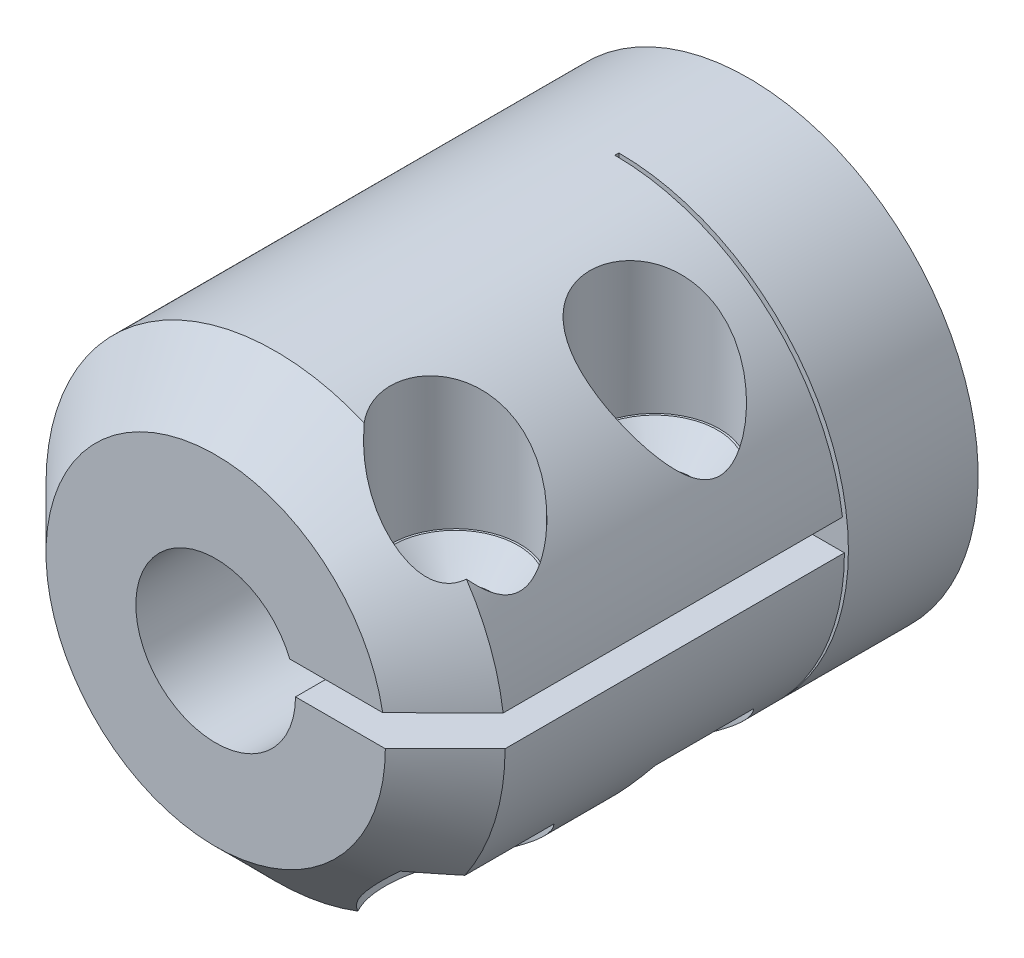
from build123d import *
from build123d.topology import SkipClean

# Parameters (mm, degrees)
SZKIC1_R                                           = 11.5
SZKIC1_R_2                                         = 4
DODANIE_WYCI_GNI_CIE1_DEPTH                        = 20
SZKIC3_W                                           = 11.5
SZKIC3_H                                           = 20
WYTNIJ_WYCI_GNI_CIE1_DEPTH                         = 1.5
WYTNIJ_WYCI_GNI_CIE2_DEPTH                         = 32
POG_BIENIE_STO_KOWE_POD_M3_WKR_T_Z_BEM_D           = 3.6
POG_BIENIE_STO_KOWE_POD_M3_WKR_T_Z_BEM_CSINK_D     = 6.3
POG_BIENIE_STO_KOWE_POD_M3_WKR_T_Z_BEM_CSINK_ANGLE = 90
SZKIC7_R                                           = 3.5
WYTNIJ_WYCI_GNI_CIE3_DEPTH                         = 32
SZKIC8_R                                           = 2
WYTNIJ_WYCI_GNI_CIE4_DEPTH                         = 7
DODANIE_WYCI_GNI_CIE2_START                        = 0.2
DODANIE_WYCI_GNI_CIE2_DEPTH                        = 0.2
DODANIE_WYCI_GNI_CIE3_START                        = 1.5
SZKIC10_R                                          = 11.5
DODANIE_WYCI_GNI_CIE3_DEPTH                        = 1.5
DODANIE_WYCI_GNI_CIE4_START                        = 5
SZKIC11_R                                          = 11.5
SZKIC11_W                                          = 10
SZKIC11_H                                          = 10
DODANIE_WYCI_GNI_CIE4_DEPTH                        = 5
SFAZOWANIE1_SIZE                                   = 3


with BuildPart() as part:
    # Szkic1 → Dodanie-wyciągnięcie1 (new body)
    with BuildSketch(Plane.XY):
        with Locations(Location((0, 0, 0), (0, 0, 180))):
            Circle(SZKIC1_R)
        with Locations(Location((0, 0, 0), (0, 0, 180))):
            Circle(SZKIC1_R_2, mode=Mode.SUBTRACT)
    extrude(amount=DODANIE_WYCI_GNI_CIE1_DEPTH)

    # Szkic3 → Wytnij-wyciągnięcie1 (cut)
    with BuildSketch(Plane(origin=(0, 0, 0), x_dir=(1, 0, 0), z_dir=(0, 1, 0))):
        with Locations((5.75, -10)):
            Rectangle(SZKIC3_W, SZKIC3_H)
    extrude(amount=WYTNIJ_WYCI_GNI_CIE1_DEPTH, mode=Mode.SUBTRACT)

    # Szkic4 → Wytnij-wyciągnięcie2 (cut)
    with BuildSketch(Plane(origin=(0, 4, 0), x_dir=(1, 0, 0), z_dir=(0, 1, 0))):
        with BuildLine():
            ThreePointArc((7, -11.75), (3.75, -15), (7, -18.25))
            Line((7, -18.25), (7, -11.75))
        make_face()
        with BuildLine():
            Line((7, -11.75), (7, -18.25))
            ThreePointArc((7, -18.25), (9.298097039, -17.298097039), (10.25, -15))
            ThreePointArc((10.25, -15), (9.298097039, -12.701902961), (7, -11.75))
        make_face()
        with BuildLine():
            ThreePointArc((7, -1.75), (3.75, -5), (7, -8.25))
            Line((7, -8.25), (7, -1.75))
        make_face()
        with BuildLine():
            Line((7, -1.75), (7, -8.25))
            ThreePointArc((7, -8.25), (9.298097039, -7.298097039), (10.25, -5))
            ThreePointArc((10.25, -5), (9.298097039, -2.701902961), (7, -1.75))
        make_face()
    extrude(amount=WYTNIJ_WYCI_GNI_CIE2_DEPTH, mode=Mode.SUBTRACT)

    # Pogłębienie stożkowe pod M3 Wkręt z łbem płaskim1 (through all)
    with Locations(Plane(origin=(7, 4, 15), x_dir=(0, 0, 1), z_dir=(0, 1, 0))):
        with Locations((0, 0), (-10, 0)):
            CounterSinkHole(POG_BIENIE_STO_KOWE_POD_M3_WKR_T_Z_BEM_D / 2, POG_BIENIE_STO_KOWE_POD_M3_WKR_T_Z_BEM_CSINK_D / 2, counter_sink_angle=POG_BIENIE_STO_KOWE_POD_M3_WKR_T_Z_BEM_CSINK_ANGLE)

    # Szkic7 → Wytnij-wyciągnięcie3 (cut)
    with BuildSketch(Plane(origin=(0, -6.5, 0), x_dir=(-1, 0, 0), z_dir=(0, -1, 0))):
        with Locations((-7, -5)):
            Circle(SZKIC7_R)
        with Locations((-7, -15)):
            Circle(SZKIC7_R)
    extrude(amount=WYTNIJ_WYCI_GNI_CIE3_DEPTH, mode=Mode.SUBTRACT)

    # Szkic8 → Wytnij-wyciągnięcie4 (cut)
    with BuildSketch(Plane.XZ.offset(6.5)):
        with Locations((7, 15)):
            Circle(SZKIC8_R)
        with Locations(Location((7, 5, 0), (0, 0, 90))):
            Circle(SZKIC8_R)
    extrude(amount=-WYTNIJ_WYCI_GNI_CIE4_DEPTH, mode=Mode.SUBTRACT)

    # Szkic9 → Dodanie-wyciągnięcie2 (add)
    with SkipClean():  # the faces are left unmerged after this step: merging them gives an invalid solid
        with BuildSketch(Plane(origin=(0, 0, 0), x_dir=(-1, 0, 0), z_dir=(0, 0, -1)).offset(DODANIE_WYCI_GNI_CIE2_START)):
            with BuildLine():
                Line((0, 11.5), (0, 4))
                ThreePointArc((0, 4), (4, 0), (0, -4))
                Line((0, -4), (0, -11.5))
                ThreePointArc((0, -11.5), (11.5, 0), (0, 11.5))
            make_face()
        extrude(amount=-DODANIE_WYCI_GNI_CIE2_DEPTH)

    # Szkic10 → Dodanie-wyciągnięcie3 (add)
    with SkipClean():  # the faces are left unmerged after this step: merging them gives an invalid solid
        with BuildSketch(Plane(origin=(0, 0, -0.2), x_dir=(-1, 0, 0), z_dir=(0, 0, -1)).offset(DODANIE_WYCI_GNI_CIE3_START)):
            Circle(SZKIC10_R)
        extrude(amount=-DODANIE_WYCI_GNI_CIE3_DEPTH)

    # Szkic11 → Dodanie-wyciągnięcie4 (add)
    with SkipClean():  # the faces are left unmerged after this step: merging them gives an invalid solid
        with BuildSketch(Plane(origin=(0, 0, -1.7), x_dir=(-1, 0, 0), z_dir=(0, 0, -1)).offset(DODANIE_WYCI_GNI_CIE4_START)):
            Circle(SZKIC11_R)
            Rectangle(SZKIC11_W, SZKIC11_H, mode=Mode.SUBTRACT)
        extrude(amount=-DODANIE_WYCI_GNI_CIE4_DEPTH)

    # Sfazowanie1
    # the kernel refuses this chamfer: 3 mm, written as the material it takes off along each edge
    with BuildSketch(Plane(origin=(0, 0, 20), x_dir=(-1, 0, 0), z_dir=(0, 1, 0))) as sfazowanie1_piece_1:
        Polygon((11.5, -SFAZOWANIE1_SIZE), (11.5 - SFAZOWANIE1_SIZE, 0), (11.5, 0), align=None)
    revolve(axis=Axis((0, 0, 20), (0, 0, 1)), revolution_arc=218.500054596, mode=Mode.SUBTRACT)
    with BuildSketch(Plane(origin=(0, 0, 20), x_dir=(0.8571646812696857, -0.5150424343525863, 0), z_dir=(-0.5150424343525863, -0.8571646812696857, 0))) as sfazowanie1_piece_2:
        Polygon((11.5, -SFAZOWANIE1_SIZE), (11.5 - SFAZOWANIE1_SIZE, 0), (11.5, 0), align=None)
    revolve(axis=Axis((0, 0, 20), (0, 0, 1)), revolution_arc=211.000291399, mode=Mode.SUBTRACT)


solid = part.part
